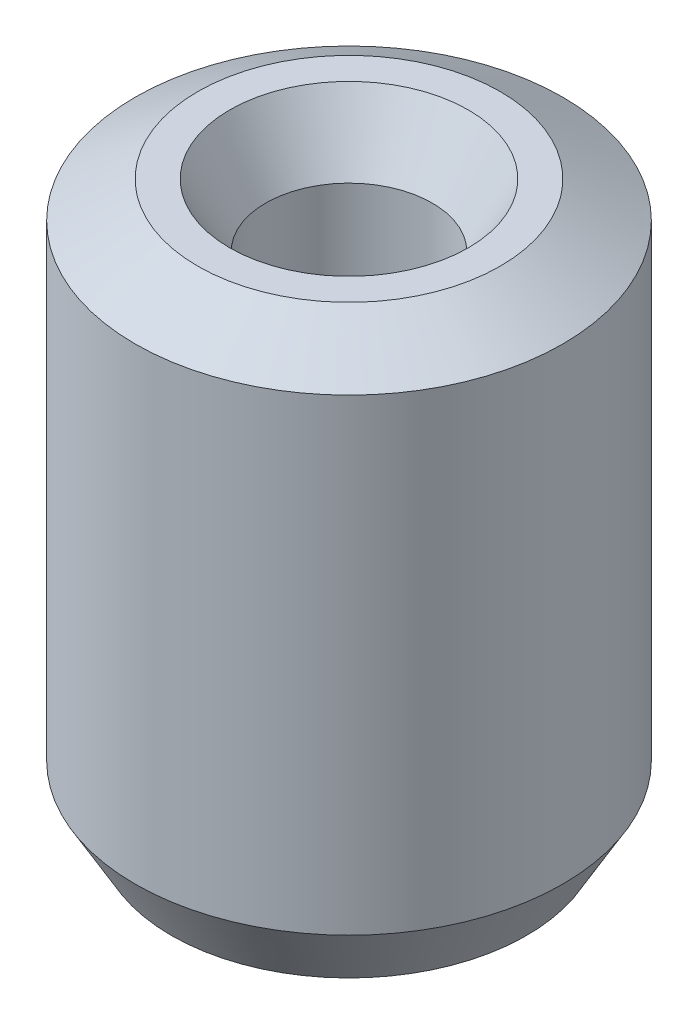
from build123d import *
from OCP.BRepFilletAPI import BRepFilletAPI_MakeChamfer

# Parameters (mm, degrees)
SKETCH1_R           = 7.5
BOSS_EXTRUDE1_DEPTH = 19.869869028
SKETCH2_R           = 2.921605895
CUT_EXTRUDE1_DEPTH  = 23.52358087
CHAMFER1_SIZE       = 1.266998045
CHAMFER1_SIZE2      = 2.194504987


with BuildPart() as part:
    # Sketch1 → Boss-Extrude1 (new body)
    with BuildSketch(Plane(origin=(0, 0, 0), x_dir=(1, 0, 0), z_dir=(0, 1, 0))):
        Circle(SKETCH1_R)
    extrude(amount=BOSS_EXTRUDE1_DEPTH)

    # Sketch2 → Cut-Extrude1 (cut, through all)
    with BuildSketch(Plane(origin=(0, 0, 0), x_dir=(1, 0, 0), z_dir=(0, 1, 0))):
        Circle(SKETCH2_R)
    extrude(amount=CUT_EXTRUDE1_DEPTH, mode=Mode.SUBTRACT)

    # Chamfer1: one chamfer whose edges measure the first distance from different faces: ONE call of the kernel's chamfer builder (chamfer() names one face for all edges)
    chamfer1_edges_1 = [part.edges().sort_by_distance(p)[0] for p in [
        (-2.921605895, 19.869869028, 0),
    ]]
    chamfer1_side_1 = [part.faces().sort_by_distance(p)[0] for p in [
        (-7.287867966, 19.869869028, 0),
    ]]
    chamfer1_edges_2 = [part.edges().sort_by_distance(p)[0] for p in [
        (-2.921605895, 0, 0),
    ]]
    chamfer1_side_2 = [part.faces().sort_by_distance(p)[0] for p in [
        (-2.921605895, 9.934934514, 0),
    ]]
    chamfer1_edges_3 = [part.edges().sort_by_distance(p)[0] for p in [
        (-7.5, 0, 0),
    ]]
    chamfer1_side_3 = [part.faces().sort_by_distance(p)[0] for p in [
        (-7.287867966, 0, 0),
    ]]
    chamfer1_edges_4 = [part.edges().sort_by_distance(p)[0] for p in [
        (-7.5, 19.869869028, 0),
    ]]
    chamfer1_side_4 = [part.faces().sort_by_distance(p)[0] for p in [
        (-7.5, 9.934934514, 0),
    ]]
    chamfer1 = BRepFilletAPI_MakeChamfer(part.part.solid().wrapped)
    for e in chamfer1_edges_1:
        chamfer1.Add(CHAMFER1_SIZE, CHAMFER1_SIZE2, e.wrapped, chamfer1_side_1[0].wrapped)  # the first distance lies on this face
    for e in chamfer1_edges_2:
        chamfer1.Add(CHAMFER1_SIZE, CHAMFER1_SIZE2, e.wrapped, chamfer1_side_2[0].wrapped)  # the first distance lies on this face
    for e in chamfer1_edges_3:
        chamfer1.Add(CHAMFER1_SIZE, CHAMFER1_SIZE2, e.wrapped, chamfer1_side_3[0].wrapped)  # the first distance lies on this face
    for e in chamfer1_edges_4:
        chamfer1.Add(CHAMFER1_SIZE, CHAMFER1_SIZE2, e.wrapped, chamfer1_side_4[0].wrapped)  # the first distance lies on this face
    add(Compound.cast(chamfer1.Shape()), mode=Mode.REPLACE)


solid = part.part
